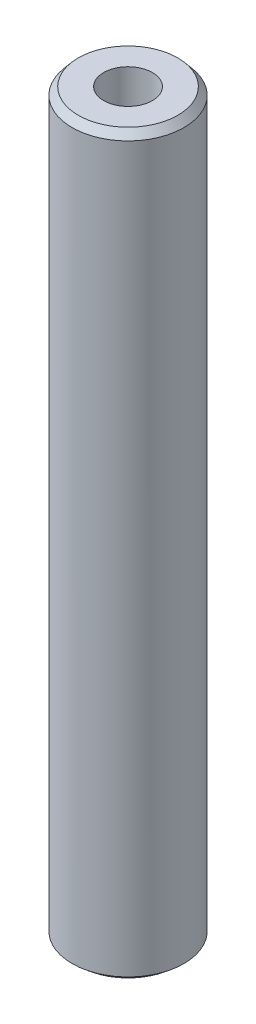
from build123d import *
from OCP.BRepFilletAPI import BRepFilletAPI_MakeChamfer

# Parameters (mm, degrees)
SKETCH1_R           = 25
BOSS_EXTRUDE1_DEPTH = 329.390721549
SKETCH2_R           = 10.871493382
CUT_EXTRUDE1_DEPTH  = 332.282730372
CHAMFER1_SIZE       = 3.350507087
CHAMFER1_SIZE2      = 2.784275481


with BuildPart() as part:
    # Sketch1 → Boss-Extrude1 (new body)
    with BuildSketch(Plane(origin=(0, 0, 0), x_dir=(1, 0, 0), z_dir=(0, 1, 0))):
        Circle(SKETCH1_R)
    extrude(amount=BOSS_EXTRUDE1_DEPTH)

    # Sketch2 → Cut-Extrude1 (cut, through all)
    with BuildSketch(Plane(origin=(0, 0, 0), x_dir=(1, 0, 0), z_dir=(0, 1, 0))):
        Circle(SKETCH2_R)
    extrude(amount=CUT_EXTRUDE1_DEPTH, mode=Mode.SUBTRACT)

    # Chamfer1: one chamfer whose edges measure the first distance from different faces: ONE call of the kernel's chamfer builder (chamfer() names one face for all edges)
    chamfer1_edges_1 = [part.edges().sort_by_distance(p)[0] for p in [
        (-25, 329.390721549, 0),
    ]]
    chamfer1_side_1 = [part.faces().sort_by_distance(p)[0] for p in [
        (-25, 164.695360775, 0),
    ]]
    chamfer1_edges_2 = [part.edges().sort_by_distance(p)[0] for p in [
        (-25, 0, 0),
    ]]
    chamfer1_side_2 = [part.faces().sort_by_distance(p)[0] for p in [
        (-24.292893219, 0, 0),
    ]]
    chamfer1 = BRepFilletAPI_MakeChamfer(part.part.solid().wrapped)
    for e in chamfer1_edges_1:
        chamfer1.Add(CHAMFER1_SIZE, CHAMFER1_SIZE2, e.wrapped, chamfer1_side_1[0].wrapped)  # the first distance lies on this face
    for e in chamfer1_edges_2:
        chamfer1.Add(CHAMFER1_SIZE, CHAMFER1_SIZE2, e.wrapped, chamfer1_side_2[0].wrapped)  # the first distance lies on this face
    add(Compound.cast(chamfer1.Shape()), mode=Mode.REPLACE)


solid = part.part
